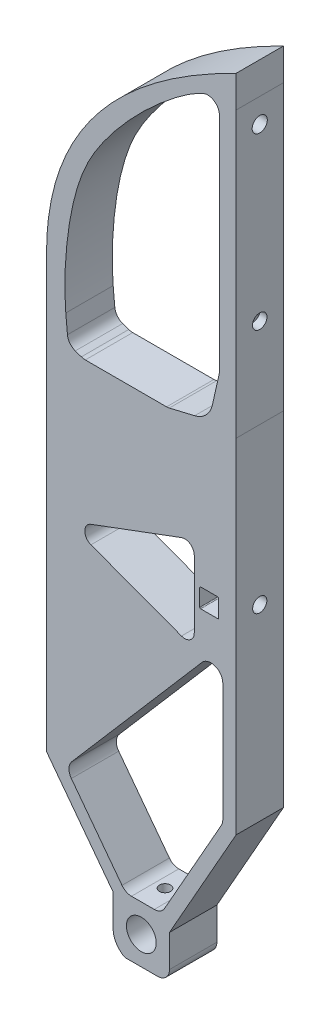
from build123d import *

# Parameters (mm, degrees)
SKETCH1_W                       = 50.8
SKETCH1_H                       = 279.4
BOSS_EXTRUDE1_DEPTH             = 12.7
SKETCH4_R                       = 3.175
CUT_EXTRUDE9_DEPTH              = 285.264471927
SKETCH12_R                      = 2.032
CUT_EXTRUDE7_DEPTH              = 10.16
SKETCH13_R                      = 3.999992
CUT_EXTRUDE8_DEPTH              = 285.264471927
CUT_EXTRUDE10_DEPTH             = 285.264471927
CUT_EXTRUDE11_START             = -1.503205808
CUT_EXTRUDE11_OUTLINE_R         = 1.938274984
CUT_EXTRUDE11_DEPTH             = 1.503205808
CUT_EXTRUDE11_START_2           = 48.41965954
CUT_EXTRUDE11_2_OUTLINE_R       = 1.938274984
CUT_EXTRUDE11_2_DEPTH           = 0.877134652
CUT_EXTRUDE11_START_3           = -2
CUT_EXTRUDE11_3_OUTLINE_W       = 7
CUT_EXTRUDE11_3_OUTLINE_H       = 7
CUT_EXTRUDE11_3_DEPTH           = 1.390444415
CUT_EXTRUDE12_REACH             = 228.331
SKETCH25_R                      = 1.499997
SKETCH27_R                      = 3.175
BOSS_EXTRUDE2_DEPTH             = 12.7
BOSS_EXTRUDE3_DEPTH             = 12.7
CUT_EXTRUDE13_REACH             = 286.264
SKETCH30_W                      = 5.08
SKETCH30_H                      = 5.08
FILLET1_R                       = 0.254
BOSS_EXTRUDE4_DEPTH             = 12.7
BOSS_EXTRUDE6_DEPTH             = 12.7
CUT_EXTRUDE16_DEPTH             = 12.7
FILLET2_R                       = 2.54
CUT_EXTRUDE15_REACH             = 285.469
SKETCH33_R                      = 1.905
CUT_EXTRUDE15_DIRECTION_2_REACH = 285.469


with BuildPart() as part:
    # Sketch1 → Boss-Extrude1 (new body)
    with BuildSketch(Plane.XY):
        with Locations((25.4, 139.7)):
            Rectangle(SKETCH1_W, SKETCH1_H)
    extrude(amount=-BOSS_EXTRUDE1_DEPTH)

    # Sketch4 → Cut-Extrude9 (cut, through all)
    with BuildSketch(Plane.XY):
        with Locations((23.83643591, 185.629212401)):
            Circle(SKETCH4_R)
    extrude(amount=-CUT_EXTRUDE9_DEPTH, mode=Mode.SUBTRACT)

    # Sketch12 → Cut-Extrude7 (cut)
    with BuildSketch(Plane(origin=(50.8, 0, 0), x_dir=(0, 0, -1), z_dir=(1, 0, 0))):
        with Locations(Location((6.35, 264.414, 0), (0, 0, 90))):
            Circle(SKETCH12_R)
    extrude(amount=-CUT_EXTRUDE7_DEPTH, mode=Mode.SUBTRACT)

    # Sketch13 → Cut-Extrude8 (cut, through all)
    with BuildSketch(Plane.XY):
        with Locations((25.4, 66.765991822)):
            Circle(SKETCH13_R)
    extrude(amount=-CUT_EXTRUDE8_DEPTH, mode=Mode.SUBTRACT)

    # Sketch23 → Cut-Extrude10 (cut, through all)
    with BuildSketch(Plane.XY):
        with BuildLine():
            ThreePointArc((9.684585518, 189.97530689), (6.134029107, 191.135611391), (3.936744482, 188.114899944))
            Line((3.936744482, 188.114899944), (3.936744482, 146.137041934))
            ThreePointArc((3.936744482, 146.137041934), (5.718074121, 143.284269963), (9.063237662, 143.632586032))
            Line((9.063237662, 143.632586032), (28.478072635, 158.76078933))
            ThreePointArc((28.478072635, 158.76078933), (29.669890916, 160.817787912), (29.09942049, 163.125652178))
            Line((29.09942049, 163.125652178), (9.684585518, 189.97530689))
        make_face()
        with BuildLine():
            ThreePointArc((25.454329065, 180.059457716), (24.214328296, 177.76665467), (24.841195831, 175.236519336))
            Line((24.841195831, 175.236519336), (41.277424699, 151.829201394))
            ThreePointArc((41.277424699, 151.829201394), (44.832564118, 150.626331551), (47.050818, 153.653749901))
            Line((47.050818, 153.653749901), (47.050818, 185.147561676))
            ThreePointArc((47.050818, 185.147561676), (46.630207739, 186.726790021), (45.479818209, 187.887599691))
            Line((45.479818209, 187.887599691), (44.197770493, 188.638101981))
            ThreePointArc((44.197770493, 188.638101981), (43.361590273, 188.9788232), (42.463311258, 189.070382588))
            Line((42.463311258, 189.070382588), (36.797920165, 188.837397982))
            ThreePointArc((36.797920165, 188.837397982), (35.770181972, 188.621293865), (34.869165079, 188.081742811))
            Line((34.869165079, 188.081742811), (25.454329065, 180.059457716))
        make_face()
        with BuildLine():
            Line((17.844008, 72.826525287), (0, 96.485678179))
            Line((0, 96.485678179), (0, 0))
            Line((0, 0), (50.8, 0))
            Line((50.8, 0), (50.8, 102.563019115))
            Line((50.8, 102.563019115), (32.955992, 71.020999822))
            Line((32.955992, 71.020999822), (32.955992, 62.384999822))
            ThreePointArc((32.955992, 62.384999822), (32.02605603, 60.139935792), (29.780992, 59.209999822))
            Line((29.780992, 59.209999822), (21.019008, 59.209999822))
            ThreePointArc((21.019008, 59.209999822), (18.702744933, 61.302679759), (17.844008, 64.303838667))
            Line((17.844008, 64.303838667), (17.844008, 72.826525287))
        make_face()
        with BuildLine():
            Line((0, 279.4), (0, 212.713248228))
            add(Edge.make_bspline(
                [(50.8, 279.4), (0.142999661, 254.58086249), (0, 212.713248228)],
                knots=[0, 0, 0, 0.994370092, 0.994370092, 0.994370092], degree=2))
            Line((50.8, 279.4), (0, 279.4))
        make_face()
        with BuildLine():
            Line((41.663820171, 138.060133531), (6.771583692, 97.569215865))
            ThreePointArc((6.771583692, 97.569215865), (6.003443965, 95.599886341), (6.641897139, 93.584774692))
            Line((6.641897139, 93.584774692), (20.224698456, 75.575503845))
            ThreePointArc((20.224698456, 75.575503845), (21.343482484, 74.645615997), (22.759564839, 74.312329523))
            Line((22.759564839, 74.312329523), (28.880684896, 74.312329523))
            ThreePointArc((28.880684896, 74.312329523), (30.480220228, 74.744682677), (31.644124603, 75.923991431))
            Line((31.644124603, 75.923991431), (46.832439707, 102.771666463))
            ThreePointArc((46.832439707, 102.771666463), (47.139386463, 103.526702652), (47.244, 104.335004554))
            Line((47.244, 104.335004554), (47.244, 135.987518036))
            ThreePointArc((47.244, 135.987518036), (45.174481579, 138.963847231), (41.663820171, 138.060133531))
        make_face()
        with BuildLine():
            Line((46.355, 208.340265374), (46.355, 267.410375004))
            ThreePointArc((46.355, 267.410375004), (45.339538097, 269.737824297), (42.942703805, 270.57649495))
            add(Edge.make_bspline(
                [(5.151800286, 200.939735337), (4.443406818, 208.580073659), (5.142632502, 230.03866236), (23.019678506, 258.304051629), (39.986259259, 270.354913629), (42.942703805, 270.57649495)],
                knots=[0.110917616, 0.110917616, 0.110917616, 0.110917616, 0.428445761, 0.512326632, 0.949726322, 0.949726322, 0.949726322, 0.949726322], degree=3))
            Line((5.151800286, 200.939735337), (5.599599739, 196.110019261))
            ThreePointArc((5.599599739, 196.110019261), (6.255400613, 194.453166983), (7.7004375, 193.410524834))
            Line((7.7004375, 193.410524834), (9.323596038, 192.835266777))
            ThreePointArc((9.323596038, 192.835266777), (9.8461136, 192.698810545), (10.384198625, 192.652882214))
            Line((10.384198625, 192.652882214), (32.17055899, 192.652882214))
            ThreePointArc((32.17055899, 192.652882214), (32.540085896, 192.674459492), (32.904590198, 192.738898047))
            Line((32.904590198, 192.738898047), (39.706586273, 194.355247347))
            ThreePointArc((39.706586273, 194.355247347), (42.752792223, 196.067358416), (44.431961055, 199.131846471))
            Line((44.431961055, 199.131846471), (46.198437199, 206.938896164))
            ThreePointArc((46.198437199, 206.938896164), (46.315737921, 207.635221479), (46.355, 208.340265374))
        make_face()
        with BuildLine():
            Line((29.980948296, 155.351785669), (4.812598642, 135.740395164))
            ThreePointArc((4.812598642, 135.740395164), (3.886943233, 134.599566539), (3.556, 133.168201993))
            Line((3.556, 133.168201993), (3.556, 110.456761818))
            ThreePointArc((3.556, 110.456761818), (5.634129033, 107.41794452), (9.219765375, 108.252356215))
            Line((9.219765375, 108.252356215), (40.635310398, 142.496582814))
            ThreePointArc((40.635310398, 142.496582814), (41.467985487, 144.51174404), (40.804546499, 146.588778291))
            Line((40.804546499, 146.588778291), (34.441290858, 154.793171429))
            ThreePointArc((34.441290858, 154.793171429), (32.32699686, 155.997718798), (29.980948296, 155.351785669))
        make_face()
    extrude(amount=-CUT_EXTRUDE10_DEPTH, mode=Mode.SUBTRACT)

    # Cut-Extrude11: read off the stored shape, not the designer's step
    # Cut-Extrude11 outline → Cut-Extrude11 (cut)
    with BuildSketch(Plane(origin=(50.8, 0, 0), x_dir=(0, 0, -1), z_dir=(1, 0, 0)).offset(CUT_EXTRUDE11_START)):
        with Locations((6.35, 218.694)):
            Circle(CUT_EXTRUDE11_OUTLINE_R)
    extrude(amount=CUT_EXTRUDE11_DEPTH, mode=Mode.SUBTRACT)

    # Cut-Extrude11 2 outline → Cut-Extrude11 2 (cut)
    with BuildSketch(Plane.YZ.offset(CUT_EXTRUDE11_START_2)):
        with Locations((218.694, -6.35)):
            Circle(CUT_EXTRUDE11_2_OUTLINE_R)
    extrude(amount=CUT_EXTRUDE11_2_DEPTH, mode=Mode.SUBTRACT)

    # Cut-Extrude11 3 outline → Cut-Extrude11 3 (add)
    with BuildSketch(Plane(origin=(0, 0, 0), x_dir=(0.22068806457460396, 0.9753444407768548, 0), z_dir=(0.9753444407768548, -0.22068806457460394, 0)).offset(CUT_EXTRUDE11_START_3)):
        with Locations((224.5, -6.5)):
            Rectangle(CUT_EXTRUDE11_3_OUTLINE_W, CUT_EXTRUDE11_3_OUTLINE_H)
    extrude(amount=CUT_EXTRUDE11_3_DEPTH)

    # Cut-Extrude12: up to this face of the body (flat: up to its plane)
    cut_extrude12_end = Plane(part.part.faces().sort_by_distance((25.820124867, 74.312329523, -6.35))[0])
    # Sketch25 → Cut-Extrude12 (cut, up to the picked face)
    with BuildSketch(Plane.XZ.offset(-59.209999822), mode=Mode.PRIVATE) as cut_extrude12_sk1:
        with Locations(Location((25.4, -6.35, 0), (0, 0, 270))):
            Circle(SKETCH25_R)
    cut_extrude12_tool1 = split(extrude(cut_extrude12_sk1.sketch, amount=-CUT_EXTRUDE12_REACH, mode=Mode.PRIVATE), bisect_by=cut_extrude12_end, keep=Keep.BOTH, mode=Mode.PRIVATE)
    add(cut_extrude12_tool1.solids().sort_by(Axis((25.4, 59.21, -6.35), (0, 1, 0)))[0], mode=Mode.SUBTRACT)

    # Sketch27 → Boss-Extrude2 (add)
    with BuildSketch(Plane.XY):
        with Locations((23.83643591, 185.629212401)):
            Circle(SKETCH27_R)
    extrude(amount=-BOSS_EXTRUDE2_DEPTH)

    # Sketch23<5> → Boss-Extrude3 (add)
    with BuildSketch(Plane.XY):
        with BuildLine():
            ThreePointArc((34.869165079, 188.081742811), (35.770181972, 188.621293865), (36.797920165, 188.837397982))
            Line((36.797920165, 188.837397982), (42.463311258, 189.070382588))
            ThreePointArc((42.463311258, 189.070382588), (43.361590273, 188.9788232), (44.197770493, 188.638101981))
            Line((44.197770493, 188.638101981), (45.479818209, 187.887599691))
            ThreePointArc((45.479818209, 187.887599691), (46.630207739, 186.726790021), (47.050818, 185.147561676))
            Line((47.050818, 185.147561676), (47.050818, 153.653749901))
            ThreePointArc((47.050818, 153.653749901), (44.832564118, 150.626331551), (41.277424699, 151.829201394))
            Line((41.277424699, 151.829201394), (24.841195831, 175.236519336))
            ThreePointArc((24.841195831, 175.236519336), (24.214328296, 177.76665467), (25.454329065, 180.059457716))
            Line((25.454329065, 180.059457716), (34.869165079, 188.081742811))
        make_face()
    extrude(amount=-BOSS_EXTRUDE3_DEPTH)

    # Sketch30 → Cut-Extrude13 (cut, up to next)
    with BuildSketch(Plane.XY, mode=Mode.PRIVATE) as cut_extrude13_sk1:
        with Locations((43.600124867, 152.861829523)):
            Rectangle(SKETCH30_W, SKETCH30_H)
    cut_extrude13_tool1 = extrude(cut_extrude13_sk1.sketch, amount=-CUT_EXTRUDE13_REACH, mode=Mode.PRIVATE) & part.part
    add(cut_extrude13_tool1.solids().sort_by_distance((43.600125, 152.86183, 0))[0], mode=Mode.SUBTRACT)

    # Fillet1
    fillet1_edges = [part.edges().sort_by_distance(p)[0] for p in [
        (41.060124867, 150.321829523, -6.35),
        (41.060124867, 155.401829523, -6.35),
        (46.140124867, 155.401829523, -6.35),
        (46.140124867, 150.321829523, -6.35),
    ]]
    fillet(fillet1_edges, radius=FILLET1_R)

    # Sketch23<6> → Boss-Extrude4 (add)
    with BuildSketch(Plane.XY):
        with BuildLine():
            ThreePointArc((29.980948296, 155.351785669), (32.32699686, 155.997718798), (34.441290858, 154.793171429))
            Line((34.441290858, 154.793171429), (40.804546499, 146.588778291))
            ThreePointArc((40.804546499, 146.588778291), (41.467985487, 144.51174404), (40.635310398, 142.496582814))
            Line((40.635310398, 142.496582814), (9.219765375, 108.252356215))
            ThreePointArc((9.219765375, 108.252356215), (5.634129033, 107.41794452), (3.556, 110.456761818))
            Line((3.556, 110.456761818), (3.556, 133.168201993))
            ThreePointArc((3.556, 133.168201993), (3.886943233, 134.599566539), (4.812598642, 135.740395164))
            Line((4.812598642, 135.740395164), (29.980948296, 155.351785669))
        make_face()
    extrude(amount=-BOSS_EXTRUDE4_DEPTH)

    # Sketch23<7> → Boss-Extrude6 (add)
    with BuildSketch(Plane.XY):
        with BuildLine():
            ThreePointArc((3.936744482, 188.114899944), (6.134029107, 191.135611391), (9.684585518, 189.97530689))
            Line((9.684585518, 189.97530689), (29.09942049, 163.125652178))
            ThreePointArc((29.09942049, 163.125652178), (29.669890916, 160.817787912), (28.478072635, 158.76078933))
            Line((28.478072635, 158.76078933), (9.063237662, 143.632586032))
            ThreePointArc((9.063237662, 143.632586032), (5.718074121, 143.284269963), (3.936744482, 146.137041934))
            Line((3.936744482, 146.137041934), (3.936744482, 188.114899944))
        make_face()
    extrude(amount=-BOSS_EXTRUDE6_DEPTH)

    # Sketch37 → Cut-Extrude16 (cut)
    with BuildSketch(Plane(origin=(0, 0, -12.7), x_dir=(-1, 0, 0), z_dir=(0, 0, -1))):
        Polygon((-5.500124867, 152.861829523), (-39.593154467, 165.561829523), (-39.593154467, 140.161829523), align=None)
    extrude(amount=-CUT_EXTRUDE16_DEPTH, mode=Mode.SUBTRACT)

    # Fillet2
    fillet2_edges = [part.edges().sort_by_distance(p)[0] for p in [
        (5.500124867, 152.861829523, -6.35),
        (39.593154467, 140.161829523, -6.35),
        (39.593154467, 165.561829523, -6.35),
    ]]
    fillet(fillet2_edges, radius=FILLET2_R)

    # Cut-Extrude15: up to this face of the body (flat: up to its plane)
    cut_extrude15_end = Plane(part.part.faces().sort_by_distance((50.8, 190.405374974, -6.35))[0])
    # Sketch33 → Cut-Extrude15 (cut, up to the picked face)
    with BuildSketch(Plane.ZY.offset(-46.140124867), mode=Mode.PRIVATE) as cut_extrude15_sk1:
        with Locations((-6.35, 152.861829523)):
            Circle(SKETCH33_R)
    cut_extrude15_tool1 = split(extrude(cut_extrude15_sk1.sketch, amount=-CUT_EXTRUDE15_REACH, mode=Mode.PRIVATE), bisect_by=cut_extrude15_end, keep=Keep.BOTH, mode=Mode.PRIVATE)
    add(cut_extrude15_tool1.solids().sort_by(Axis((46.140125, 152.86183, -6.35), (1, 0, 0)))[0], mode=Mode.SUBTRACT)

    # Cut-Extrude15 direction 2: up to this face of the body (flat: up to its plane)
    cut_extrude15_direction_2_end = Plane(part.part.faces().sort_by_distance((39.593154467, 152.861829523, -6.35))[0])
    # Sketch33 → Cut-Extrude15 direction 2 (cut, up to the picked face)
    with BuildSketch(Plane.ZY.offset(-46.140124867), mode=Mode.PRIVATE) as cut_extrude15_direction_2_sk1:
        with Locations((-6.35, 152.861829523)):
            Circle(SKETCH33_R)
    cut_extrude15_direction_2_tool1 = split(extrude(cut_extrude15_direction_2_sk1.sketch, amount=CUT_EXTRUDE15_DIRECTION_2_REACH, mode=Mode.PRIVATE), bisect_by=cut_extrude15_direction_2_end, keep=Keep.BOTH, mode=Mode.PRIVATE)
    add(cut_extrude15_direction_2_tool1.solids().sort_by(Axis((46.140125, 152.86183, -6.35), (-1, 0, 0)))[0], mode=Mode.SUBTRACT)


solid = part.part
